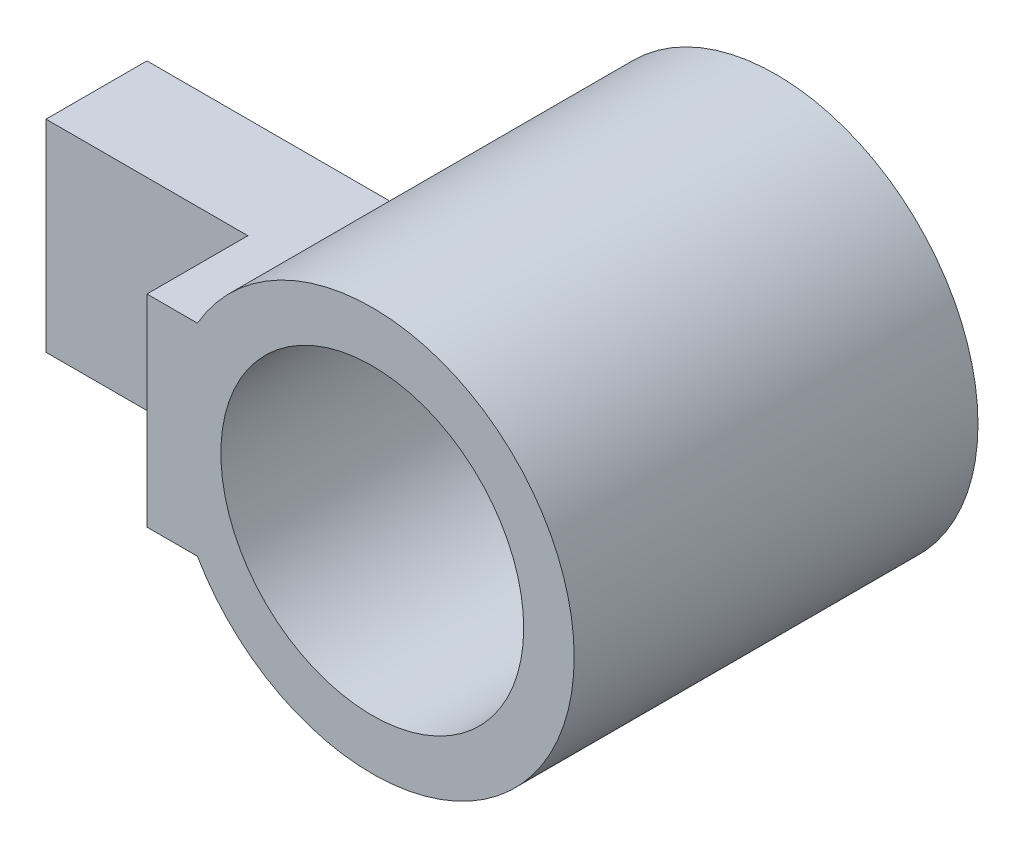
from build123d import *

# Parameters (mm, degrees)
CROQUIS1_R              = 20
SALIENTE_EXTRUIR1_DEPTH = 20
CROQUIS6_R              = 15
CORTAR_EXTRUIR1_DEPTH   = 49.989794856
CROQUIS7_W              = 25
CROQUIS7_H              = 20
SALIENTE_EXTRUIR3_DEPTH = 20
CROQUIS8_W              = 20
CROQUIS8_H              = 20
CORTAR_EXTRUIR2_DEPTH   = 10


with BuildPart() as part:
    # Croquis1 → Saliente-Extruir1 (new, symmetric)
    with BuildSketch(Plane.XY):
        Circle(CROQUIS1_R)
    extrude(amount=SALIENTE_EXTRUIR1_DEPTH, both=True)

    # Croquis6 → Cortar-Extruir1 (cut, through all)
    with BuildSketch(Plane.XY.offset(20)):
        Circle(CROQUIS6_R)
    extrude(amount=-CORTAR_EXTRUIR1_DEPTH, mode=Mode.SUBTRACT)

    # Croquis7 → Saliente-Extruir3 (add)
    with BuildSketch(Plane.XY.offset(20)):
        with Locations((-29.820508076, 0)):
            Rectangle(CROQUIS7_W, CROQUIS7_H)
    extrude(amount=-SALIENTE_EXTRUIR3_DEPTH)

    # Croquis8 → Cortar-Extruir2 (cut)
    with BuildSketch(Plane(origin=(0, 0, 20), x_dir=(-1, 0, 0), z_dir=(0, 0, -1))):
        with Locations((32.320508076, 0)):
            Rectangle(CROQUIS8_W, CROQUIS8_H)
        with Locations((-32.320508076, 0)):
            Rectangle(CROQUIS8_W, CROQUIS8_H)
    extrude(amount=CORTAR_EXTRUIR2_DEPTH, mode=Mode.SUBTRACT)


solid = part.part
